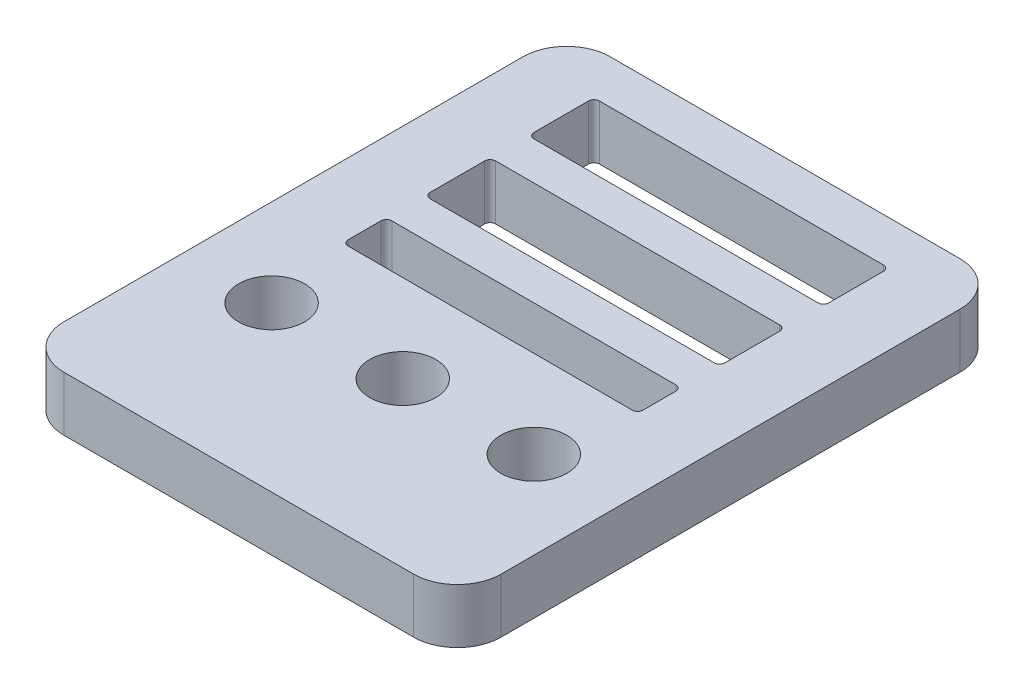
from build123d import *

# Parameters (mm, degrees)
SKETCH1_W            = 40
SKETCH1_H            = 50
BOSS_EXTRUDE1_DEPTH  = 5
SKETCH2_W            = 27
SKETCH2_H            = 6
SKETCH2_H_2          = 4
CUT_EXTRUDE1_DEPTH   = 33.403703492
SKETCH3_R            = 3.025
CUT_EXTRUDE2_DEPTH   = 33.403703492
LPATTERN1_COUNT      = 2
LPATTERN1_PITCH      = 12
LPATTERN1_COUNT_DIR2 = 2
LPATTERN1_PITCH_DIR2 = 12
FILLET1_R            = 4
FILLET2_R            = 0.5


with BuildPart() as part:
    # Sketch1 → Boss-Extrude1 (new body)
    with BuildSketch(Plane(origin=(0, 0, 0), x_dir=(1, 0, 0), z_dir=(0, 1, 0))):
        Rectangle(SKETCH1_W, SKETCH1_H)
    extrude(amount=BOSS_EXTRUDE1_DEPTH)

    # Sketch2 → Cut-Extrude1 (cut, through all)
    with BuildSketch(Plane(origin=(0, 5, 0), x_dir=(1, 0, 0), z_dir=(0, 1, 0))):
        with Locations((0, 18)):
            Rectangle(SKETCH2_W, SKETCH2_H)
        with Locations((0, 8.5)):
            Rectangle(SKETCH2_W, SKETCH2_H)
        Rectangle(SKETCH2_W, SKETCH2_H_2)
    extrude(amount=-CUT_EXTRUDE1_DEPTH, mode=Mode.SUBTRACT)

    # Sketch3 → Cut-Extrude2 (cut, through all)
    with BuildSketch(Plane(origin=(0, 5, 0), x_dir=(1, 0, 0), z_dir=(0, 1, 0))):
        with Locations((0, -10)):
            Circle(SKETCH3_R)
    cut_extrude2 = extrude(amount=-CUT_EXTRUDE2_DEPTH, mode=Mode.SUBTRACT)

    # LPattern1: Cut-Extrude2 2 × 2
    with Locations(*[Vector(1, 0, 0) * (i * LPATTERN1_PITCH) + Vector(-1, 0, 0) * (j * LPATTERN1_PITCH_DIR2) for i in range(LPATTERN1_COUNT) for j in range(LPATTERN1_COUNT_DIR2) if (i, j) != (0, 0)]):
        add(cut_extrude2, mode=Mode.SUBTRACT)

    # Fillet1
    fillet1_edges = [part.edges().sort_by_distance(p)[0] for p in [
        (20, 2.5, 25),
        (-20, 2.5, 25),
        (20, 2.5, -25),
        (-20, 2.5, -25),
    ]]
    fillet(fillet1_edges, radius=FILLET1_R)

    # Fillet2
    fillet2_edges = [part.edges().sort_by_distance(p)[0] for p in [
        (13.5, 2.5, -15),
        (13.5, 2.5, -5.5),
        (13.5, 2.5, 2),
        (-13.5, 2.5, 2),
        (-13.5, 2.5, -5.5),
        (-13.5, 2.5, -15),
        (-13.5, 2.5, -21),
        (-13.5, 2.5, -11.5),
        (-13.5, 2.5, -2),
        (13.5, 2.5, -2),
        (13.5, 2.5, -11.5),
        (13.5, 2.5, -21),
    ]]
    fillet(fillet2_edges, radius=FILLET2_R)


solid = part.part
